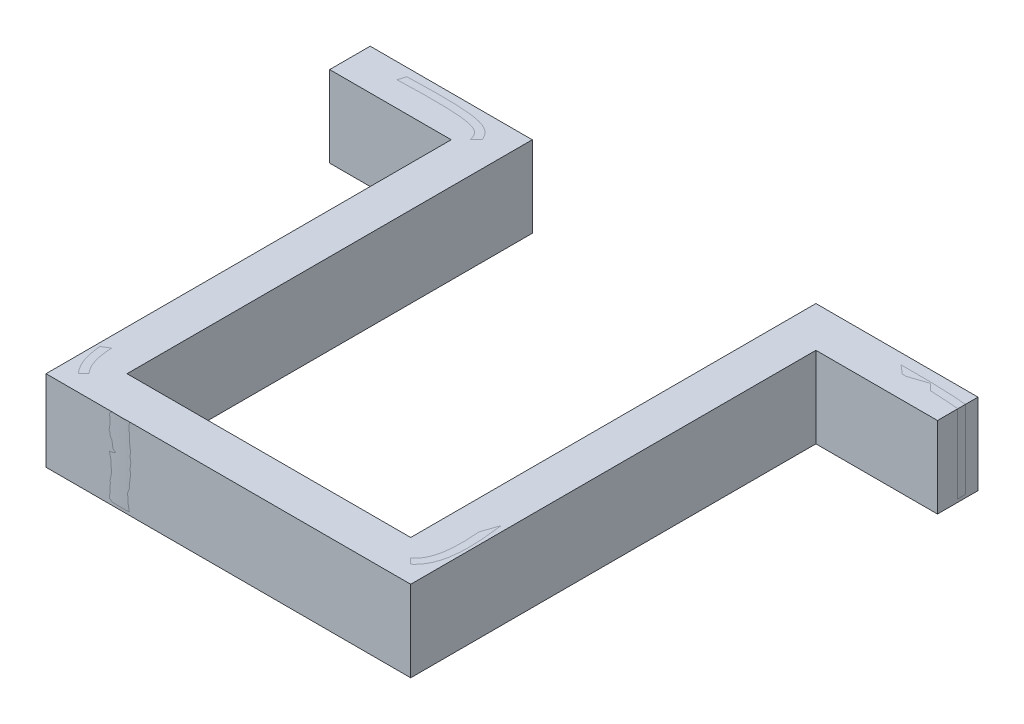
from build123d import *

# Parameters (mm, degrees)
BOSS_EXTRUDE1_DEPTH = 20
SWEEP1_START        = 0.735501347
SWEEP1_DEPTH        = 19.264498653


# Read off the part's stored shape, not the designer's step: Sweep1
with BuildPart() as part:
    # Sketch2 → Boss-Extrude1 (new body)
    with BuildSketch(Plane(origin=(0, 0, 0), x_dir=(1, 0, 0), z_dir=(0, 1, 0))):
        Polygon((-10, 10), (0, 10), (0, 0), (0, -90), (70, -90), (70, 0), (70, 10), (80, 10), (110, 10), (110, 0), (80, 0), (80, -100), (-10, -100), (-10, 0), (-40, 0), (-40, 10), align=None)
    extrude(amount=BOSS_EXTRUDE1_DEPTH)


with BuildPart() as body_2:
    # Sweep1 outline → Sweep1 (new body)
    with BuildSketch(Plane(origin=(0, 0, 0), x_dir=(1, 0, 0), z_dir=(0, 1, 0)).offset(SWEEP1_START)):
        with BuildLine():
            Line((110, 4.998976477), (110, 6.860797707))
            add(Edge.make_bspline(
                [(110, 6.860797707), (109.021920926, 7.001764754), (107.199094066, 7.143581906), (102.504398108, 7.355408199), (99.632528998, 7.425417342), (90.404038266, 7.417470434), (83.434533215, 7.121540083), (77.73536538, 6.161006497), (77.275443846, 6.076250731), (76.393153797, 5.81976759), (75.970785278, 5.648040253), (75.172401045, 5.140278224), (74.796385328, 4.804243569), (74.099506486, 3.890531171), (73.778809187, 3.311197034), (72.911528998, 1.105882482), (72.45705064, -0.960368626), (71.780617792, -6.051681957), (71.558663303, -9.076744185), (70.99296803, -26.015903923), (72.281458765, -45.371547247), (75.713512411, -69.160035377), (76.742534479, -75.056385052), (77.436792609, -82.652190163), (77.52666616, -84.976005302), (77.244293243, -89.048494228), (76.872046782, -90.797168018), (75.76306499, -93.008746568), (75.231236726, -93.7062469), (73.856917876, -94.883084017), (73.006486532, -95.363172999), (69.93761324, -96.53984174), (67.239881679, -96.969196231), (57.935288634, -97.591588852), (50.11702877, -97.118956121), (40.406984422, -96.734969917), (38.180244078, -96.661967336), (33.679358817, -96.644898394), (31.39023722, -96.714749234), (24.436521642, -97.115279486), (19.725194665, -97.600121475), (10.890047892, -98.230663023), (6.766228091, -98.376362587), (1.575034045, -97.759465564), (0.01039197, -97.414592164), (-2.695062748, -96.349514981), (-3.835875394, -95.629311201), (-5.920733044, -93.370733497), (-6.644251022, -91.630618296), (-7.430226411, -87.453193648), (-7.492683817, -85.015884197), (-7.132675861, -76.925864894), (-6.162830314, -70.49506408), (-5.400340648, -60.497178254), (-5.257832805, -57.179061629), (-5.020732002, -50.531876319), (-4.912808433, -47.207250533), (-4.591402492, -37.366649394), (-4.403162933, -30.976325339), (-4.235128666, -19.158582259), (-4.255333957, -13.731163233), (-4.660572102, -4.461981832), (-5.04560495, -0.620219455), (-5.871419212, 2.881300981), (-6.071890981, 3.559269528), (-6.606089536, 4.757756555), (-6.9398163, 5.278275031), (-7.83318883, 6.176399145), (-8.392834571, 6.554004779), (-9.830709028, 7.18084043), (-10.708937726, 7.430070446), (-13.960494236, 8.007002905), (-16.950692433, 8.163947758), (-25.317388387, 8.138781696), (-30.693886136, 7.956670781), (-37.634189574, 7.663180882)],
                knots=[0, 0, 0, 0, 0.068815951, 0.068815951, 0.137631903, 0.137631903, 0.275263805, 0.275263805, 0.28775762, 0.28775762, 0.300251436, 0.300251436, 0.312745251, 0.312745251, 0.325239066, 0.325239066, 0.350226696, 0.350226696, 0.375214327, 0.375214327, 0.475164848, 0.475164848, 0.509582011, 0.509582011, 0.526790592, 0.526790592, 0.543999174, 0.543999174, 0.554335966, 0.554335966, 0.564672758, 0.564672758, 0.585346342, 0.585346342, 0.62669351, 0.62669351, 0.639241537, 0.639241537, 0.651789565, 0.651789565, 0.67688562, 0.67688562, 0.701981675, 0.701981675, 0.714529702, 0.714529702, 0.72707773, 0.72707773, 0.744165695, 0.744165695, 0.76125366, 0.76125366, 0.79542959, 0.79542959, 0.81184108, 0.81184108, 0.82825257, 0.82825257, 0.861075551, 0.861075551, 0.893898531, 0.893898531, 0.926721512, 0.926721512, 0.935881323, 0.935881323, 0.945041134, 0.945041134, 0.954200945, 0.954200945, 0.963360756, 0.963360756, 0.981680378, 0.981680378, 1, 1, 1, 1], degree=3))
            Line((-37.634189574, 7.663180882), (-37.290975947, 5.833267579))
            add(Edge.make_bspline(
                [(110, 4.998976477), (109.14914649, 5.143873749), (107.350070759, 5.28762595), (102.717943451, 5.505606896), (99.870765676, 5.578669683), (90.729105183, 5.583313642), (83.809218317, 5.286528831), (78.321089742, 4.393622723), (77.92925544, 4.328385603), (77.278222277, 4.176856806), (77.02109037, 4.095863926), (76.548167351, 3.867619912), (76.322589672, 3.718255066), (75.8259364, 3.16381905), (75.56089829, 2.756511068), (74.78375017, 0.933471892), (74.319711198, -1.026004108), (73.641372194, -5.944885744), (73.414129115, -8.916795615), (72.824195224, -25.636004807), (74.096625658, -44.944666802), (77.489429081, -68.599888474), (78.525833983, -74.508284905), (79.261577132, -82.277906996), (79.372159208, -84.68666296), (79.112275405, -89.06285469), (78.752897624, -91.042108628), (77.460607243, -93.803777055), (76.797829814, -94.74346278), (75.090978157, -96.29981473), (74.053901401, -96.910719742), (70.565936122, -98.321411503), (67.724860925, -98.76947596), (58.12930464, -99.453864556), (50.282549751, -98.973604508), (40.607762722, -98.585951948), (38.403586258, -98.510686986), (33.973222618, -98.483726864), (31.733446638, -98.544884994), (24.863466804, -98.928382177), (20.161886685, -99.410481708), (11.245556505, -100.058699598), (7.037277296, -100.232019581), (1.508930025, -99.623505964), (-0.207910746, -99.27607132), (-3.332566668, -98.111998872), (-4.750893436, -97.284724491), (-7.447247612, -94.529391567), (-8.33266696, -92.447512126), (-9.265600506, -87.83980178), (-9.337714889, -85.277424064), (-9.000910167, -76.953008022), (-8.026337049, -70.532369367), (-7.255164988, -60.663833045), (-7.109875684, -57.369840619), (-6.870842018, -50.740568379), (-6.763489754, -47.410623795), (-6.44144373, -37.575792136), (-6.252162089, -31.195411275), (-6.078869273, -19.418230287), (-6.095533114, -14.01997507), (-6.47921528, -4.86482449), (-6.8601365, -1.09344746), (-7.581164217, 2.141671797), (-7.740642415, 2.71514804), (-8.087385733, 3.616251418), (-8.263342375, 3.94409557), (-8.748042154, 4.534814698), (-9.072732384, 4.809957684), (-10.136717292, 5.334135183), (-10.873015162, 5.572596208), (-13.813636049, 6.13943079), (-16.728266846, 6.314804939), (-24.997544042, 6.303978737), (-30.359709491, 6.125222133), (-37.290975947, 5.833267579)],
                knots=[0, 0, 0, 0, 0.068815951, 0.068815951, 0.137631903, 0.137631903, 0.275263805, 0.275263805, 0.28775762, 0.28775762, 0.300251436, 0.300251436, 0.312745251, 0.312745251, 0.325239066, 0.325239066, 0.350226696, 0.350226696, 0.375214327, 0.375214327, 0.475164848, 0.475164848, 0.509582011, 0.509582011, 0.526790592, 0.526790592, 0.543999174, 0.543999174, 0.554335966, 0.554335966, 0.564672758, 0.564672758, 0.585346342, 0.585346342, 0.62669351, 0.62669351, 0.639241537, 0.639241537, 0.651789565, 0.651789565, 0.67688562, 0.67688562, 0.701981675, 0.701981675, 0.714529702, 0.714529702, 0.72707773, 0.72707773, 0.744165695, 0.744165695, 0.76125366, 0.76125366, 0.79542959, 0.79542959, 0.81184108, 0.81184108, 0.82825257, 0.82825257, 0.861075551, 0.861075551, 0.893898531, 0.893898531, 0.926721512, 0.926721512, 0.935881323, 0.935881323, 0.945041134, 0.945041134, 0.954200945, 0.954200945, 0.963360756, 0.963360756, 0.981680378, 0.981680378, 1, 1, 1, 1], degree=3))
        make_face()
    extrude(amount=SWEEP1_DEPTH)


solid = Compound([part.part, body_2.part])
